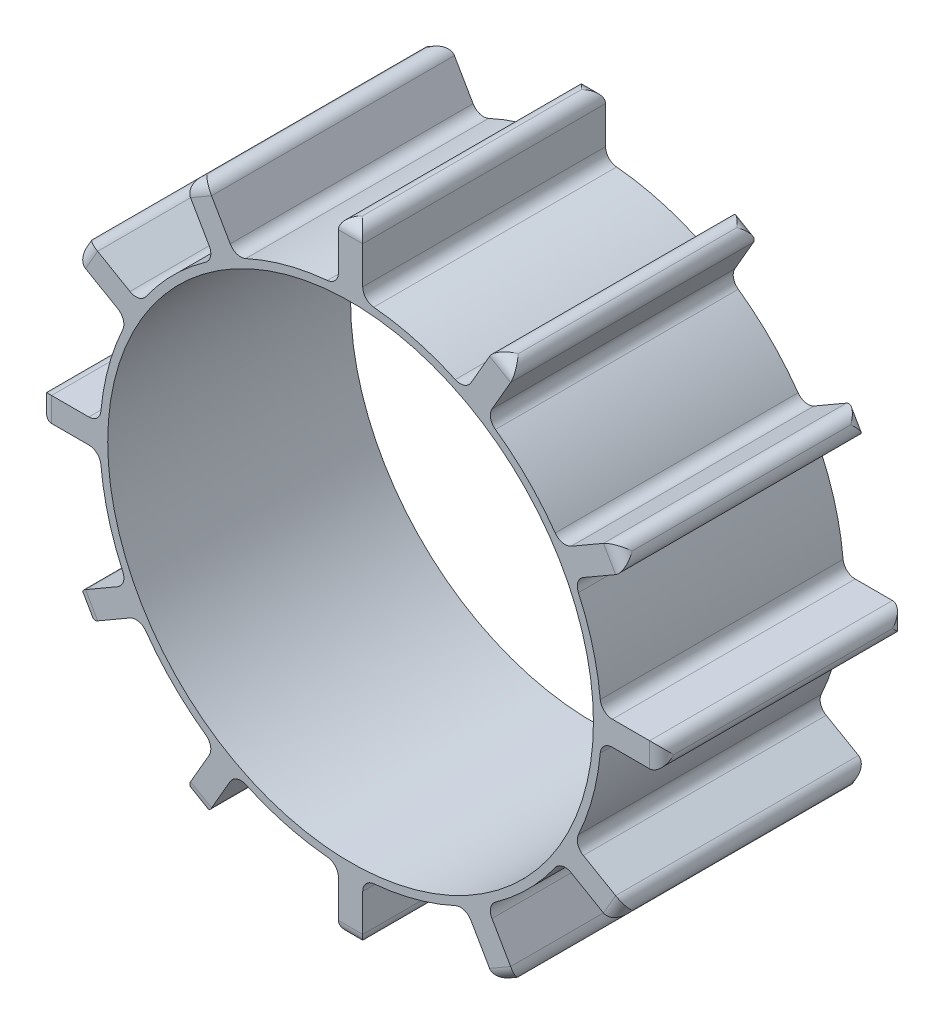
from build123d import *

# Parameters (mm, degrees)
SKIZZE1_R                       = 20
AUFSATZ_LINEAR_AUSTRAGEN2_DEPTH = 20
VERRUNDUNG1_R                   = 1


with BuildPart() as part:
    # Skizze1 → Aufsatz-Linear austragen2 (new body)
    with BuildSketch(Plane.XY):
        with BuildLine():
            Line((-22.692570161, 11.946860953), (-18.362443142, 9.446860953))
            ThreePointArc((-18.362443142, 9.446860953), (-19.946368313, 5.344613281), (-20.625772713, 1))
            Line((-20.625772713, 1), (-25.625772713, 1))
            Line((-25.625772713, 1), (-25.625772713, -1))
            Line((-25.625772713, -1), (-20.625772713, -1))
            ThreePointArc((-20.625772713, -1), (-19.946368313, -5.344613281), (-18.362443142, -9.446860953))
            Line((-18.362443142, -9.446860953), (-22.692570161, -11.946860953))
            Line((-22.692570161, -11.946860953), (-21.692570161, -13.67891176))
            Line((-21.692570161, -13.67891176), (-17.362443142, -11.17891176))
            ThreePointArc((-17.362443142, -11.17891176), (-14.601755032, -14.601755032), (-11.17891176, -17.362443142))
            Line((-11.17891176, -17.362443142), (-13.67891176, -21.692570161))
            Line((-13.67891176, -21.692570161), (-11.946860953, -22.692570161))
            Line((-11.946860953, -22.692570161), (-9.446860953, -18.362443142))
            ThreePointArc((-9.446860953, -18.362443142), (-5.344613281, -19.946368313), (-1, -20.625772713))
            Line((-1, -20.625772713), (-1, -25.625772713))
            Line((-1, -25.625772713), (1, -25.625772713))
            Line((1, -25.625772713), (1, -20.625772713))
            ThreePointArc((1, -20.625772713), (5.344613281, -19.946368313), (9.446860953, -18.362443142))
            Line((9.446860953, -18.362443142), (11.946860953, -22.692570161))
            Line((11.946860953, -22.692570161), (13.67891176, -21.692570161))
            Line((13.67891176, -21.692570161), (11.17891176, -17.362443142))
            ThreePointArc((11.17891176, -17.362443142), (14.601755032, -14.601755032), (17.362443142, -11.17891176))
            Line((17.362443142, -11.17891176), (21.692570161, -13.67891176))
            Line((21.692570161, -13.67891176), (22.692570161, -11.946860953))
            Line((22.692570161, -11.946860953), (18.362443142, -9.446860953))
            ThreePointArc((18.362443142, -9.446860953), (19.946368313, -5.344613281), (20.625772713, -1))
            Line((20.625772713, -1), (25.625772713, -1))
            Line((25.625772713, -1), (25.625772713, 1))
            Line((25.625772713, 1), (20.625772713, 1))
            ThreePointArc((20.625772713, 1), (19.946368313, 5.344613281), (18.362443142, 9.446860953))
            Line((18.362443142, 9.446860953), (22.692570161, 11.946860953))
            Line((22.692570161, 11.946860953), (21.692570161, 13.67891176))
            Line((21.692570161, 13.67891176), (17.362443142, 11.17891176))
            ThreePointArc((17.362443142, 11.17891176), (14.601755032, 14.601755032), (11.17891176, 17.362443142))
            Line((11.17891176, 17.362443142), (13.67891176, 21.692570161))
            Line((13.67891176, 21.692570161), (11.946860953, 22.692570161))
            Line((11.946860953, 22.692570161), (9.446860953, 18.362443142))
            ThreePointArc((9.446860953, 18.362443142), (5.344613281, 19.946368313), (1, 20.625772713))
            Line((1, 20.625772713), (1, 25.625772713))
            Line((1, 25.625772713), (-1, 25.625772713))
            Line((-1, 25.625772713), (-1, 20.625772713))
            ThreePointArc((-1, 20.625772713), (-5.344613281, 19.946368313), (-9.446860953, 18.362443142))
            Line((-9.446860953, 18.362443142), (-11.946860953, 22.692570161))
            Line((-11.946860953, 22.692570161), (-13.67891176, 21.692570161))
            Line((-13.67891176, 21.692570161), (-11.17891176, 17.362443142))
            ThreePointArc((-11.17891176, 17.362443142), (-14.601755032, 14.601755032), (-17.362443142, 11.17891176))
            Line((-17.362443142, 11.17891176), (-21.692570161, 13.67891176))
            Line((-21.692570161, 13.67891176), (-22.692570161, 11.946860953))
        make_face()
        Circle(SKIZZE1_R, mode=Mode.SUBTRACT)
    extrude(amount=AUFSATZ_LINEAR_AUSTRAGEN2_DEPTH)

    # Verrundung1
    verrundung1_edges = [part.edges().sort_by_distance(p)[0] for p in [
        (25.625772713, 0, 20),
        (22.192570161, 12.812886356, 20),
        (-25.625772713, 0, 20),
        (12.812886356, 22.192570161, 20),
        (0, 25.625772713, 20),
        (-12.812886356, 22.192570161, 20),
        (-22.192570161, 12.812886356, 20),
        (-22.192570161, -12.812886356, 20),
        (-12.812886356, -22.192570161, 20),
        (-22.192570161, 12.812886356, 0),
        (-12.812886356, 22.192570161, 0),
        (0, 25.625772713, 0),
        (12.812886356, 22.192570161, 0),
        (22.192570161, 12.812886356, 0),
        (25.625772713, 0, 0),
        (22.192570161, -12.812886356, 0),
        (12.812886356, -22.192570161, 0),
        (0, -25.625772713, 0),
        (-12.812886356, -22.192570161, 0),
        (0, -25.625772713, 20),
        (-22.192570161, -12.812886356, 0),
        (-25.625772713, 0, 0),
        (12.812886356, -22.192570161, 20),
        (-18.362443142, 9.446860953, 10),
        (-22.692570161, 11.946860953, 10),
        (-21.692570161, 13.67891176, 10),
        (-17.362443142, 11.17891176, 10),
        (-11.17891176, 17.362443142, 10),
        (-13.67891176, 21.692570161, 10),
        (-11.946860953, 22.692570161, 10),
        (-9.446860953, 18.362443142, 10),
        (-1, 20.625772713, 10),
        (-1, 25.625772713, 10),
        (1, 25.625772713, 10),
        (1, 20.625772713, 10),
        (9.446860953, 18.362443142, 10),
        (11.946860953, 22.692570161, 10),
        (13.67891176, 21.692570161, 10),
        (11.17891176, 17.362443142, 10),
        (17.362443142, 11.17891176, 10),
        (21.692570161, 13.67891176, 10),
        (22.692570161, 11.946860953, 10),
        (18.362443142, 9.446860953, 10),
        (20.625772713, 1, 10),
        (25.625772713, 1, 10),
        (25.625772713, -1, 10),
        (20.625772713, -1, 10),
        (18.362443142, -9.446860953, 10),
        (22.692570161, -11.946860953, 10),
        (21.692570161, -13.67891176, 10),
        (17.362443142, -11.17891176, 10),
        (11.17891176, -17.362443142, 10),
        (13.67891176, -21.692570161, 10),
        (11.946860953, -22.692570161, 10),
        (9.446860953, -18.362443142, 10),
        (1, -20.625772713, 10),
        (1, -25.625772713, 10),
        (-1, -25.625772713, 10),
        (-1, -20.625772713, 10),
        (-9.446860953, -18.362443142, 10),
        (-11.946860953, -22.692570161, 10),
        (-13.67891176, -21.692570161, 10),
        (-11.17891176, -17.362443142, 10),
        (-17.362443142, -11.17891176, 10),
        (-21.692570161, -13.67891176, 10),
        (-22.692570161, -11.946860953, 10),
        (-18.362443142, -9.446860953, 10),
        (-20.625772713, -1, 10),
        (-25.625772713, -1, 10),
        (-25.625772713, 1, 10),
        (-20.625772713, 1, 10),
        (22.192570161, -12.812886356, 20),
    ]]
    fillet(verrundung1_edges, radius=VERRUNDUNG1_R - 0.0001)  # a hair under: the kernel refuses the full size


solid = part.part
